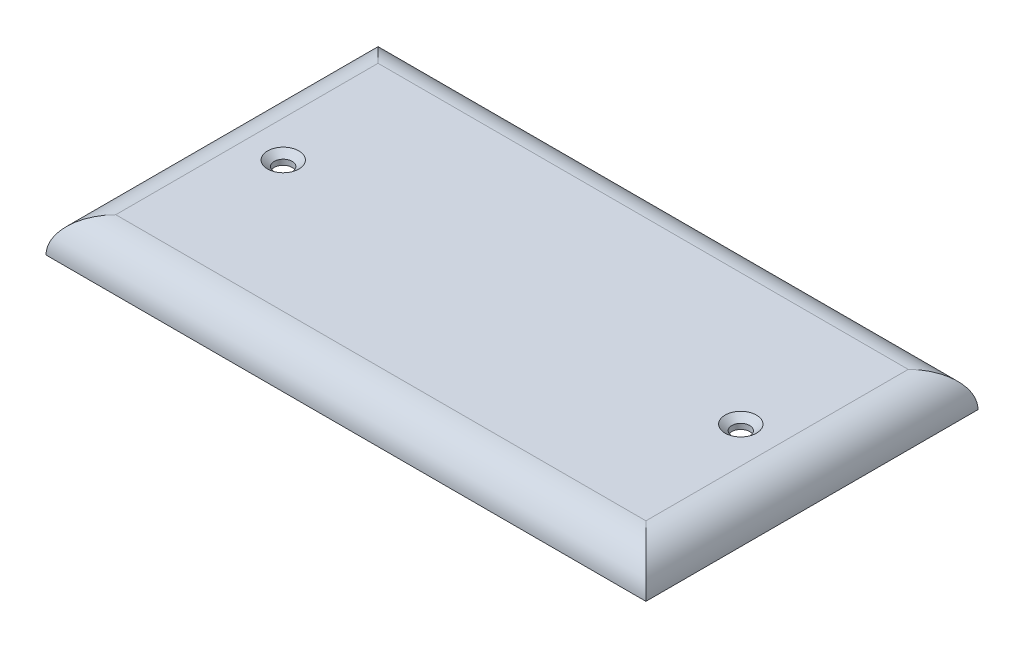
from build123d import *

# Parameters (mm, degrees)
SKETCH2_W                                         = 109.22
SKETCH2_H                                         = 60.452
BOSS_EXTRUDE1_DEPTH                               = 3.175
FILLET3_R                                         = 6.35
SHELL1_T                                          = -2
CSK_FOR_4_FLAT_HEAD_MACHINE_SCREW_100_D           = 3.2639
CSK_FOR_4_FLAT_HEAD_MACHINE_SCREW_100_CSINK_D     = 5.715
CSK_FOR_4_FLAT_HEAD_MACHINE_SCREW_100_CSINK_ANGLE = 100


with BuildPart() as part:
    # Sketch2 → Boss-Extrude1 (new, symmetric)
    with BuildSketch(Plane(origin=(0, 0, 0), x_dir=(1, 0, 0), z_dir=(0, 1, 0))):
        Rectangle(SKETCH2_W, SKETCH2_H)
    extrude(amount=BOSS_EXTRUDE1_DEPTH, both=True)

    # Fillet3
    fillet3_edges = [part.edges().sort_by_distance(p)[0] for p in [
        (-54.61, 3.175, 0),
        (0, 3.175, -30.226),
        (54.61, 3.175, 0),
        (0, 3.175, 30.226),
    ]]
    fillet(fillet3_edges, radius=FILLET3_R - 0.0001)  # a hair under: the kernel refuses the full size

    # Shell1
    shell1_openings = [part.faces().sort_by_distance(p)[0] for p in [
        (0, -3.175, 0),
    ]]
    offset(amount=SHELL1_T, openings=shell1_openings)

    # CSK for #4 Flat Head Machine Screw (100)1 (through all)
    with Locations(Plane(origin=(0, 3.175, 0), x_dir=(1, 0, 0), z_dir=(0, 1, 0))):
        with Locations((41.65, 0)):
            csk_for_4_flat_head_machine_screw_100 = CounterSinkHole(CSK_FOR_4_FLAT_HEAD_MACHINE_SCREW_100_D / 2, CSK_FOR_4_FLAT_HEAD_MACHINE_SCREW_100_CSINK_D / 2, counter_sink_angle=CSK_FOR_4_FLAT_HEAD_MACHINE_SCREW_100_CSINK_ANGLE)

    # Mirror1: CSK for #4 Flat Head Machine Screw (100)1 across plane
    add(csk_for_4_flat_head_machine_screw_100.mirror(Plane(origin=(0, 0, 0), x_dir=(0, 0, 1), z_dir=(1, 0, 0))), mode=Mode.SUBTRACT)


solid = part.part
